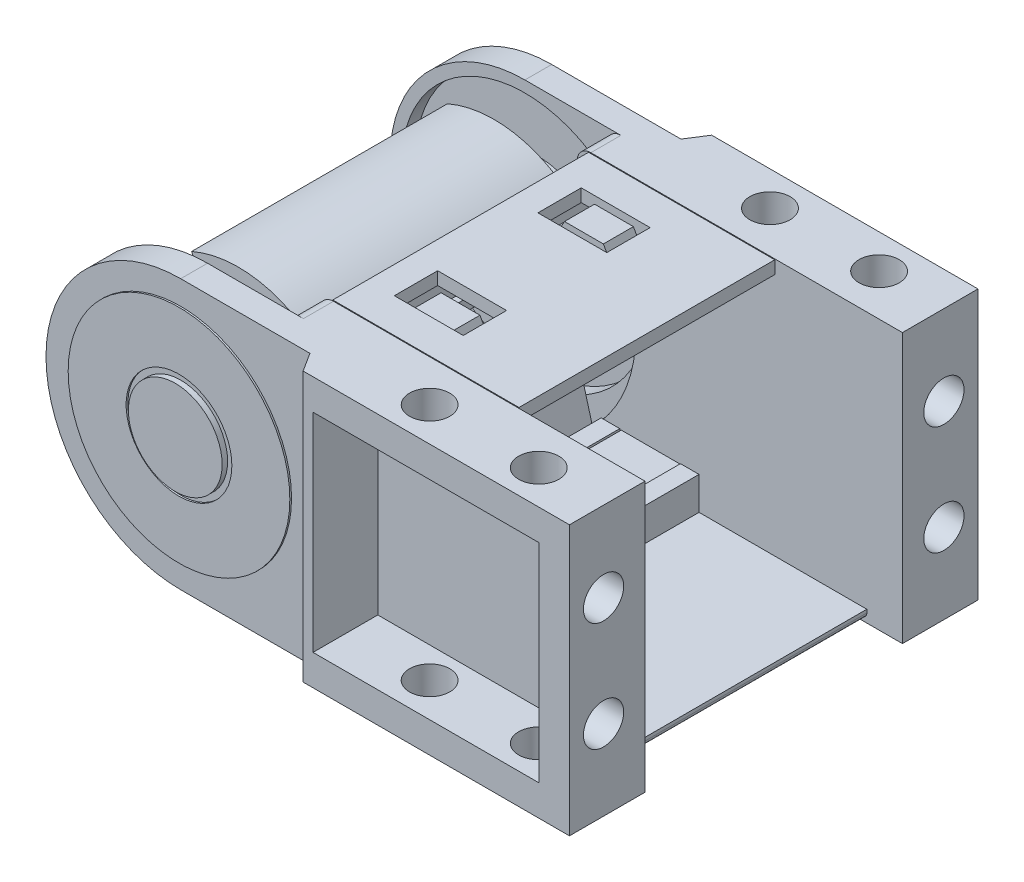
from build123d import *

# Parameters (mm, degrees)
BOSS_EXTRUDE1_START  = 29.95
BOSS_EXTRUDE1_DEPTH  = 11.08
SKETCH2_W            = 33.1
SKETCH2_H            = 30.5
CUT_EXTRUDE1_DEPTH   = 9.5
CUT_EXTRUDE2_DEPTH   = 2.75
CHAMFER1_SIZE2       = 1.75
CHAMFER1_SIZE        = 2.75
SKETCH5_R            = 16.25
SKETCH5_R_2          = 7.75
BOSS_EXTRUDE2_DEPTH  = 0.25
SKETCH5_3_R          = 5.15
CUT_EXTRUDE3_DEPTH   = 64.47845225
SKETCH6_R            = 2.95
CUT_EXTRUDE4_DEPTH   = 78.635784275
CUT_EXTRUDE5_REACH   = 89.22
SKETCH7_R            = 2.95
SKETCH8_R            = 20.65
CUT_EXTRUDE6_DEPTH   = 4.4
CUT_EXTRUDE7_START   = 4.4
SKETCH9_R            = 18.1
CUT_EXTRUDE7_DEPTH   = 6.5
SKETCH10_R           = 7
BOSS_EXTRUDE3_DEPTH  = 3.9
FILLET1_R            = 0.5
CUT_EXTRUDE8_START   = -4.6
SKETCH11_R           = 7
CUT_EXTRUDE8_DEPTH   = 4.6
FILLET2_R            = 2
BOSS_EXTRUDE4_DEPTH  = 10.92
BOSS_EXTRUDE5_START  = -1.1
BOSS_EXTRUDE5_DEPTH  = 4.4
BOSS_EXTRUDE6_DEPTH  = 18.75
SKETCH15_W           = 10.1
SKETCH15_H           = 6.35
CUT_EXTRUDE9_DEPTH   = 5
BOSS_EXTRUDE7_REACH  = 76.451
SKETCH16_W           = 14.35
SKETCH16_H           = 2
SKETCH18_R           = 6.875
BOSS_EXTRUDE9_DEPTH  = 0.8
SKETCH19_R           = 5.1
BOSS_EXTRUDE10_DEPTH = 8
SKETCH20_W           = 37.5
SKETCH20_H           = 1.88
BOSS_EXTRUDE11_DEPTH = 13.5
CHAMFER2_SIZE        = 2
CHAMFER2_SIZE2       = 0.932615316
FILLET3_R            = 0.75
FILLET4_R            = 10


# Some blends are built 0.0001 mm under size
with BuildPart() as part:
    # Sketch1 → Boss-Extrude1 (new body)
    with BuildSketch(Plane.XY.offset(BOSS_EXTRUDE1_START)):
        with BuildLine():
            Line((0, 19.75), (59.75, 19.75))
            Line((59.75, 19.75), (59.75, -19.75))
            Line((59.75, -19.75), (0, -19.75))
            ThreePointArc((0, -19.75), (-19.75, 0), (0, 19.75))
        make_face()
    extrude(amount=-BOSS_EXTRUDE1_DEPTH)

    # Sketch2 → Cut-Extrude1 (cut)
    with BuildSketch(Plane.XY.offset(29.95)):
        with Locations((38.7, 0)):
            Rectangle(SKETCH2_W, SKETCH2_H)
    extrude(amount=-CUT_EXTRUDE1_DEPTH, mode=Mode.SUBTRACT)

    # Sketch3 → Cut-Extrude2 (cut)
    with BuildSketch(Plane.XY.offset(29.95)):
        with BuildLine():
            Line((0, -19.75), (18.95, -19.75))
            Line((18.95, -19.75), (18.95, 19.75))
            Line((18.95, 19.75), (0, 19.75))
            ThreePointArc((0, 19.75), (-19.75, 0), (0, -19.75))
        make_face()
    extrude(amount=-CUT_EXTRUDE2_DEPTH, mode=Mode.SUBTRACT)

    # Chamfer1
    chamfer1_edges = [part.edges().sort_by_distance(p)[0] for p in [
        (18.95, 0, 29.95),
    ]]
    chamfer1_side = [part.faces().sort_by_distance(p)[0] for p in [
        (18.95, 0, 29.915),
    ]]
    chamfer(chamfer1_edges, length=CHAMFER1_SIZE - 0.0001, length2=CHAMFER1_SIZE2 - 0.0001, reference=chamfer1_side[0])  # a hair under: the kernel refuses the full size

    # Sketch5 → Boss-Extrude2 (add)
    with BuildSketch(Plane.XY.offset(27.2)):
        Circle(SKETCH5_R)
        Circle(SKETCH5_R_2, mode=Mode.SUBTRACT)
    extrude(amount=BOSS_EXTRUDE2_DEPTH)

    # Sketch5<3> → Cut-Extrude3 (cut, through all)
    with BuildSketch(Plane.XY.offset(27.2)):
        Circle(SKETCH5_3_R)
    extrude(amount=-CUT_EXTRUDE3_DEPTH, mode=Mode.SUBTRACT)

    # Sketch6 → Cut-Extrude4 (cut, through all)
    with BuildSketch(Plane(origin=(0, 19.75, 0), x_dir=(1, 0, 0), z_dir=(0, 1, 0))):
        with Locations(Location((50.25, -24.95, 0), (0, 0, 270))):
            Circle(SKETCH6_R)
        with Locations(Location((34.25, -24.95, 0), (0, 0, 270))):
            Circle(SKETCH6_R)
    extrude(amount=-CUT_EXTRUDE4_DEPTH, mode=Mode.SUBTRACT)

    # Sketch7 → Cut-Extrude5 (cut, up to next)
    with BuildSketch(Plane(origin=(59.75, 0, 0), x_dir=(0, 0, -1), z_dir=(1, 0, 0)), mode=Mode.PRIVATE) as cut_extrude5_sk1:
        with Locations((-24.95, 8)):
            Circle(SKETCH7_R)
    cut_extrude5_tool1 = extrude(cut_extrude5_sk1.sketch, amount=-CUT_EXTRUDE5_REACH, mode=Mode.PRIVATE) & part.part
    # Sketch7 → Cut-Extrude5 (cut, up to next)
    with BuildSketch(Plane(origin=(59.75, 0, 0), x_dir=(0, 0, -1), z_dir=(1, 0, 0)), mode=Mode.PRIVATE) as cut_extrude5_sk2:
        with Locations((-24.95, -8)):
            Circle(SKETCH7_R)
    cut_extrude5_tool2 = extrude(cut_extrude5_sk2.sketch, amount=-CUT_EXTRUDE5_REACH, mode=Mode.PRIVATE) & part.part
    add(cut_extrude5_tool1.solids().sort_by_distance((59.75, 8, 24.95))[0], mode=Mode.SUBTRACT)
    add(cut_extrude5_tool2.solids().sort_by_distance((59.75, -8, 24.95))[0], mode=Mode.SUBTRACT)

    # Sketch8 → Cut-Extrude6 (cut)
    with BuildSketch(Plane(origin=(0, 0, 18.87), x_dir=(-1, 0, 0), z_dir=(0, 0, -1))):
        Circle(SKETCH8_R)
    extrude(amount=-CUT_EXTRUDE6_DEPTH, mode=Mode.SUBTRACT)

    # Sketch9 → Cut-Extrude7 (cut)
    with BuildSketch(Plane(origin=(0, 0, 23.27), x_dir=(-1, 0, 0), z_dir=(0, 0, -1)).offset(CUT_EXTRUDE7_START)):
        Circle(SKETCH9_R)
    extrude(amount=-CUT_EXTRUDE7_DEPTH, mode=Mode.SUBTRACT)

    # Sketch10 → Boss-Extrude3 (add)
    with BuildSketch(Plane(origin=(0, 0, 25.37), x_dir=(-1, 0, 0), z_dir=(0, 0, -1))):
        with BuildLine():
            Line((8.562499635, 2.5), (16.75, 3.2))
            Line((16.75, 3.2), (16.75, -3.2))
            Line((16.75, -3.2), (8.562499635, -2.5))
            ThreePointArc((8.562499635, -2.5), (0, -8.92), (-8.562499635, -2.5))
            Line((-8.562499635, -2.5), (-16.75, -3.2))
            Line((-16.75, -3.2), (-16.75, 3.2))
            Line((-16.75, 3.2), (-8.562499635, 2.5))
            ThreePointArc((-8.562499635, 2.5), (0, 8.92), (8.562499635, 2.5))
        make_face()
        Circle(SKETCH10_R, mode=Mode.SUBTRACT)
        with BuildLine():
            Line((8.872361267, 0.920654955), (15.15, 1.457369083))
            Line((15.15, 1.457369083), (15.15, -1.457369083))
            Line((15.15, -1.457369083), (8.872361267, -0.920654955))
            ThreePointArc((8.872361267, -0.920654955), (8.92, 0), (8.872361267, 0.920654955))
        make_face(mode=Mode.SUBTRACT)
        with BuildLine():
            Line((-8.872361267, 0.920654955), (-15.15, 1.457369083))
            Line((-15.15, 1.457369083), (-15.15, -1.457369083))
            Line((-15.15, -1.457369083), (-8.872361267, -0.920654955))
            ThreePointArc((-8.872361267, -0.920654955), (-8.92, 0), (-8.872361267, 0.920654955))
        make_face(mode=Mode.SUBTRACT)
    extrude(amount=BOSS_EXTRUDE3_DEPTH)

    # Fillet1
    fillet1_edges = [part.edges().sort_by_distance(p)[0] for p in [
        (16.75, 3.2, 23.42),
        (16.75, -3.2, 23.42),
        (-16.75, -3.2, 23.42),
        (-16.75, 3.2, 23.42),
    ]]
    fillet(fillet1_edges, radius=FILLET1_R)

    # Sketch11 → Cut-Extrude8 (cut)
    with BuildSketch(Plane(origin=(0, 0, 21.47), x_dir=(-1, 0, 0), z_dir=(0, 0, -1)).offset(CUT_EXTRUDE8_START)):
        Circle(SKETCH11_R)
    extrude(amount=CUT_EXTRUDE8_DEPTH, mode=Mode.SUBTRACT)

    # Fillet2
    fillet2_edges = [part.edges().sort_by_distance(p)[0] for p in [
        (6.029925373, 19.75, 21.07),
        (6.029925373, -19.75, 21.07),
    ]]
    fillet(fillet2_edges, radius=FILLET2_R)

    # Sketch12 → Boss-Extrude4 (add)
    with BuildSketch(Plane(origin=(0, 0, 18.87), x_dir=(-1, 0, 0), z_dir=(0, 0, -1))):
        Polygon((-27.425, 17.15), (-18.325, 17.15), (-17.5, 15.65), (-17.5, 14.85), (-18.525, 14.85), (-18.525, 13.25), (-27.225, 13.25), (-27.225, 14.85), (-28.25, 14.85), (-28.25, 15.65), align=None)
        Polygon((-17.5, -15.65), (-17.5, -14.85), (-18.525, -14.85), (-18.525, -13.25), (-27.225, -13.25), (-27.225, -14.85), (-28.25, -14.85), (-28.25, -15.65), (-27.425, -17.15), (-18.325, -17.15), align=None)
    extrude(amount=BOSS_EXTRUDE4_DEPTH)

    # Sketch13 → Boss-Extrude5 (add)
    with BuildSketch(Plane(origin=(0, 0, 7.95), x_dir=(-1, 0, 0), z_dir=(0, 0, -1)).offset(BOSS_EXTRUDE5_START)):
        Polygon((-26.7, 17.15), (-25.725, 18.9), (-20.025, 18.9), (-19.05, 17.15), align=None)
        Polygon((-20.025, -18.9), (-19.05, -17.15), (-26.7, -17.15), (-25.725, -18.9), align=None)
    extrude(amount=-BOSS_EXTRUDE5_DEPTH)


with BuildPart() as body_2:
    # Sketch14 → Boss-Extrude6 (new, symmetric)
    with BuildSketch(Plane.XY):
        with BuildLine():
            Line((41.15, 19.75), (13.85, 19.75))
            Line((13.85, 19.75), (11.787175234, 12.25))
            ThreePointArc((11.787175234, 12.25), (2.971704939, 16.738248706), (-6.85, 15.558839931))
            Line((-6.85, 15.558839931), (-6.092470588, 13.83821528))
            ThreePointArc((-6.092470588, 13.83821528), (4.294757816, 14.497222331), (12.646917657, 8.286728775))
            Line((12.646917657, 8.286728775), (15.28273222, 17.87))
            Line((15.28273222, 17.87), (15.7, 17.87))
            Line((15.7, 17.87), (15.7, 13.05))
            Line((15.7, 13.05), (18.425, 13.05))
            Line((18.425, 13.05), (18.425, 14.75))
            Line((18.425, 14.75), (17.4, 14.75))
            Line((17.4, 14.75), (17.4, 17.87))
            Line((17.4, 17.87), (28.35, 17.87))
            Line((28.35, 17.87), (28.35, 14.75))
            Line((28.35, 14.75), (27.325, 14.75))
            Line((27.325, 14.75), (27.325, 13.05))
            Line((27.325, 13.05), (30.05, 13.05))
            Line((30.05, 13.05), (30.05, 17.87))
            Line((30.05, 17.87), (41.15, 17.87))
            Line((41.15, 17.87), (41.15, 19.75))
        make_face()
    extrude(amount=BOSS_EXTRUDE6_DEPTH, both=True)

    # Sketch15 → Cut-Extrude9 (cut)
    with BuildSketch(Plane(origin=(0, 19.75, 0), x_dir=(1, 0, 0), z_dir=(0, 1, 0))):
        with Locations((22.875, -10.525)):
            Rectangle(SKETCH15_W, SKETCH15_H)
        with Locations((22.875, 10.525)):
            Rectangle(SKETCH15_W, SKETCH15_H)
    extrude(amount=-CUT_EXTRUDE9_DEPTH, mode=Mode.SUBTRACT)

    # Boss-Extrude7: up to this face of the body (flat: up to its plane)
    boss_extrude7_end = Plane(body_2.part.faces().sort_by_distance((35.6, 17.87, 0))[0])
    # Sketch16 → Boss-Extrude7 (add, up to the picked face)
    with BuildSketch(Plane.XZ.offset(-13.05), mode=Mode.PRIVATE) as boss_extrude7_sk1:
        with Locations((22.875, 0)):
            Rectangle(SKETCH16_W, SKETCH16_H)
    boss_extrude7_tool1 = split(extrude(boss_extrude7_sk1.sketch, amount=-BOSS_EXTRUDE7_REACH, mode=Mode.PRIVATE), bisect_by=boss_extrude7_end, keep=Keep.BOTH, mode=Mode.PRIVATE)
    add(boss_extrude7_tool1.solids().sort_by(Axis((22.875, 13.05, 0), (0, 1, 0)))[0])


with BuildPart() as body_3:
    # Sketch18 → Boss-Extrude9 (new body)
    with BuildSketch(Plane.XY.offset(27.2)):
        Circle(SKETCH18_R)
    extrude(amount=BOSS_EXTRUDE9_DEPTH)

    # Sketch19 → Boss-Extrude10 (add)
    with BuildSketch(Plane(origin=(0, 0, 27.2), x_dir=(-1, 0, 0), z_dir=(0, 0, -1))):
        Circle(SKETCH19_R)
    extrude(amount=BOSS_EXTRUDE10_DEPTH)


with BuildPart() as body_4:
    # Mirror1: mirrored copy
    add(part.part.mirror(Plane.XY))


with BuildPart() as body_5:
    # Mirror1 2: mirrored copy
    add(body_3.part.mirror(Plane.XY))


with BuildPart() as body_6:
    # Mirror2: mirrored copy
    add(body_2.part.mirror(Plane.ZX))

    # Sketch20 → Boss-Extrude11 (add)
    with BuildSketch(Plane(origin=(41.15, 0, 0), x_dir=(0, 0, -1), z_dir=(1, 0, 0))):
        with Locations((0, -18.81)):
            Rectangle(SKETCH20_W, SKETCH20_H)
    extrude(amount=BOSS_EXTRUDE11_DEPTH)

    # Chamfer2
    chamfer2_edges = [body_6.edges().sort_by_distance(p)[0] for p in [
        (54.65, -19.75, 0),
    ]]
    chamfer2_side = [body_6.faces().sort_by_distance(p)[0] for p in [
        (35.290907486, -19.75, 0),
    ]]
    chamfer(chamfer2_edges, length=CHAMFER2_SIZE, length2=CHAMFER2_SIZE2, reference=chamfer2_side[0])

    # Fillet3
    fillet3_edges = [body_6.edges().sort_by_distance(p)[0] for p in [
        (54.65, -18.817384684, 0),
    ]]
    fillet(fillet3_edges, radius=FILLET3_R)

    # Fillet4
    # the kernel refuses this fillet: 10 mm, written as the material it takes off along each edge
    with BuildSketch(Plane(origin=(52.65, -19.75, 24.213368875), x_dir=(0.90630778703665, 0.4226182617406992, 0), z_dir=(0, 0, -1))) as fillet4_piece_1:
        with BuildLine():
            CenterArc((2.245585115, -9.986645653), FILLET4_R, 92.961401532, 22.038598468)
            Line((-1.980597502, -0.923567783), (-2.065121154, -0.742306226))
            Line((-2.065121154, -0.742306226), (-0.084523652, 0.181261557))
            Line((-0.084523652, 0.181261557), (0, 0.2))
            ThreePointArc((0, 0.2), (0.864476571, 0.2), (1.718620503, 0.199732913))
            Line((1.718620503, 0.199732913), (1.728953142, 0))
        make_face()
    extrude(amount=48.426737751, mode=Mode.SUBTRACT)


solid = Compound([part.part, body_2.part, body_3.part, body_4.part, body_5.part, body_6.part])
